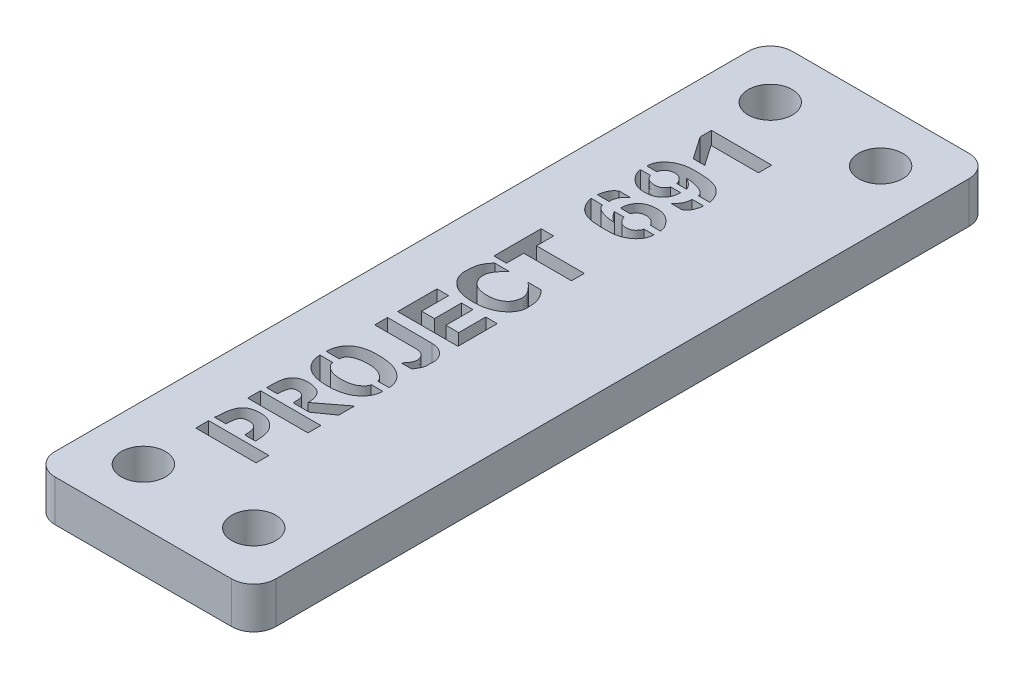
from build123d import *

# Parameters (mm, degrees)
SKETCH1_W           = 25.4
SKETCH1_H           = 84.836
BOSS_EXTRUDE1_DEPTH = 4.7625
FILLET1_R           = 2.54
SKETCH2_R           = 2.54
CUT_EXTRUDE1_DEPTH  = 4.7625
SKETCH3_W           = 6.937209635
SKETCH3_H           = 1.47773099
SKETCH3_H_2         = 1.477730989
CUT_EXTRUDE3_DEPTH  = 4.7625


with BuildPart() as part:
    # Sketch1 → Boss-Extrude1 (new body)
    with BuildSketch(Plane(origin=(0, 0, 0), x_dir=(1, 0, 0), z_dir=(0, 1, 0))):
        Rectangle(SKETCH1_W, SKETCH1_H)
    extrude(amount=BOSS_EXTRUDE1_DEPTH)

    # Fillet1
    fillet1_edges = [part.edges().sort_by_distance(p)[0] for p in [
        (12.7, 2.38125, 42.418),
        (-12.7, 2.38125, 42.418),
        (12.7, 2.38125, -42.418),
        (-12.7, 2.38125, -42.418),
    ]]
    fillet(fillet1_edges, radius=FILLET1_R)

    # Sketch2 → Cut-Extrude1 (cut)
    with BuildSketch(Plane(origin=(0, 4.7625, 0), x_dir=(1, 0, 0), z_dir=(0, 1, 0))):
        with Locations((6.35, 36.068)):
            Circle(SKETCH2_R)
        with Locations((-6.35, 36.068)):
            Circle(SKETCH2_R)
        with Locations((6.35, -36.068)):
            Circle(SKETCH2_R)
        with Locations((-6.35, -36.068)):
            Circle(SKETCH2_R)
    extrude(amount=-CUT_EXTRUDE1_DEPTH, mode=Mode.SUBTRACT)

    # Sketch3 → Cut-Extrude3 (cut)
    with BuildSketch(Plane(origin=(0, 4.7625, 0), x_dir=(1, 0, 0), z_dir=(0, 1, 0))):
        with BuildLine():
            Line((-2.204557943, -27.318811646), (-3.432489193, -27.318811646))
            add(Edge.make_bspline(
                [(-3.432489193, -27.318811646), (-3.432086244, -27.242043489), (-3.43131662, -27.095417788), (-3.444434951, -26.885090985), (-3.462893716, -26.694079451), (-3.490651172, -26.521824011), (-3.529286887, -26.369068947), (-3.578036003, -26.235963855), (-3.631503271, -26.119599112), (-3.700606609, -26.024876261), (-3.774751798, -25.94326573), (-3.859309551, -25.875236157), (-3.951313004, -25.81606595), (-4.052326275, -25.767662454), (-4.162419043, -25.732227657), (-4.279993593, -25.704130858), (-4.407280254, -25.690675175), (-4.539497775, -25.684071819), (-4.67120632, -25.68931151), (-4.795938487, -25.700663902), (-4.911135214, -25.720321161), (-5.01728325, -25.746758344), (-5.113551653, -25.782898874), (-5.20018799, -25.826377302), (-5.276644926, -25.878356426), (-5.345910846, -25.939667647), (-5.405748322, -26.021181454), (-5.455121107, -26.126788682), (-5.500796447, -26.257094486), (-5.534324196, -26.415150462), (-5.566678309, -26.59815323), (-5.589264627, -26.808329507), (-5.607848058, -27.044153478), (-5.613179732, -27.210425561), (-5.615979687, -27.297744198)],
                knots=[0, 0, 0, 0, 1.620059853, 3.094283102, 4.446036624, 5.669764395, 6.774058916, 7.765531304, 8.660548686, 9.465545705, 10.229819932, 10.982267153, 11.748884886, 12.535069155, 13.338672239, 14.18627352, 15.081979594, 16.035876351, 16.978779197, 17.861689262, 18.67809544, 19.443395835, 20.167134492, 20.8442956, 21.484521806, 22.114153355, 22.787578946, 23.602060283, 24.566476989, 25.696612031, 27.007394411, 28.488900441, 30.156128049, 32, 32, 32, 32], degree=3))
            Line((-5.615979687, -27.297744198), (-6.926675911, -27.297744198))
            add(Edge.make_bspline(
                [(-6.926675911, -27.297744198), (-6.921712564, -27.18334754), (-6.912149702, -26.962939926), (-6.889474751, -26.645831121), (-6.861772416, -26.354612775), (-6.825780895, -26.090107298), (-6.783941902, -25.851579213), (-6.736724336, -25.638719824), (-6.681792385, -25.45199614), (-6.619050018, -25.289274235), (-6.549930048, -25.145269935), (-6.475368605, -25.013851842), (-6.391670351, -24.895266674), (-6.304488565, -24.785514263), (-6.20972416, -24.687152478), (-6.106551853, -24.601539985), (-5.998363784, -24.525480797), (-5.84144082, -24.439916569), (-5.624638239, -24.353975928), (-5.338004568, -24.280368922), (-5.019882446, -24.239015253), (-4.73772238, -24.225933909), (-4.503107017, -24.233735716), (-4.327486567, -24.249429272), (-4.156796234, -24.278965653), (-3.990195633, -24.3168429), (-3.8297448, -24.371191099), (-3.672415085, -24.431572528), (-3.521002812, -24.506675475), (-3.374664778, -24.591583863), (-3.235441884, -24.686356673), (-3.104154991, -24.787205163), (-2.981621264, -24.89435255), (-2.868204891, -25.008408891), (-2.766398735, -25.131578913), (-2.670787271, -25.258608179), (-2.586590412, -25.394214474), (-2.508470134, -25.536587596), (-2.43904046, -25.693136489), (-2.382088863, -25.868028067), (-2.330052116, -26.061697568), (-2.28953676, -26.275159671), (-2.254184606, -26.507963608), (-2.229965258, -26.760683599), (-2.211124708, -27.033142019), (-2.206795653, -27.221466011), (-2.204557943, -27.318811646)],
                knots=[0, 0, 0, 0, 1.699189764, 3.273822559, 4.717445749, 6.039702003, 7.234168391, 8.310453345, 9.273716079, 10.119740721, 10.895518061, 11.642474635, 12.359027655, 13.047258987, 13.721088708, 14.381587928, 15.034110984, 15.680490903, 17.029629755, 18.483046039, 20.061106175, 21.782264105, 22.668591867, 23.543372224, 24.396343774, 25.237738208, 26.075767183, 26.907923794, 27.736877995, 28.580804131, 29.416979643, 30.23438941, 31.03619414, 31.831023051, 32.618286661, 33.405866943, 34.188612909, 34.984695714, 35.814585228, 36.725577301, 37.711441232, 38.788832536, 39.947912176, 41.204878494, 42.555187395, 44, 44, 44, 44], degree=3))
        make_face()
        with Locations((-3.468604818, -28.712272844)):
            Rectangle(SKETCH3_W, SKETCH3_H)
        with Locations((-3.468604818, -22.741156178)):
            Rectangle(SKETCH3_W, SKETCH3_H_2)
        with BuildLine():
            add(Edge.make_bspline(
                [(-3.84781888, -21.337161256), (-3.847753872, -21.265926003), (-3.847629287, -21.129407572), (-3.856412298, -20.93355259), (-3.873130803, -20.756378239), (-3.89422301, -20.597685736), (-3.925514345, -20.458660199), (-3.964855298, -20.338957205), (-4.008862139, -20.236185284), (-4.063781239, -20.151428397), (-4.128253534, -20.083185163), (-4.195373034, -20.020966344), (-4.273923765, -19.972273328), (-4.358233929, -19.928678985), (-4.451978172, -19.898349054), (-4.552643244, -19.875213633), (-4.66106172, -19.862255319), (-4.774288702, -19.857911775), (-4.88643986, -19.862473824), (-4.992170249, -19.874073649), (-5.088903823, -19.893580882), (-5.176763692, -19.919831106), (-5.254934344, -19.956278497), (-5.322499717, -20.001998193), (-5.382848358, -20.053485938), (-5.434618007, -20.116041305), (-5.477796034, -20.195189439), (-5.513801737, -20.29396158), (-5.548974097, -20.41391277), (-5.577494774, -20.55710614), (-5.604854555, -20.722633409), (-5.626833921, -20.910969515), (-5.644452056, -21.121798523), (-5.65341092, -21.269924536), (-5.658114583, -21.34769498)],
                knots=[0, 0, 0, 0, 1.704020633, 3.265661473, 4.687782663, 5.960558721, 7.092940044, 8.090949425, 8.971855951, 9.760657708, 10.491171539, 11.213658047, 11.942593241, 12.693902549, 13.479411519, 14.291598235, 15.162311024, 16.087000325, 16.999698994, 17.845156185, 18.628829851, 19.357567475, 20.033937485, 20.682928481, 21.303797403, 21.926056331, 22.613721948, 23.449414641, 24.436762231, 25.60173672, 26.93927573, 28.450017959, 30.1361567, 32, 32, 32, 32], degree=3))
            Line((-5.658114583, -21.34769498), (-6.907113281, -21.34769498))
            add(Edge.make_bspline(
                [(-6.907113281, -21.34769498), (-6.90682114, -21.22980228), (-6.906261587, -21.003997057), (-6.894238821, -20.680482609), (-6.881787593, -20.38717533), (-6.856193437, -20.1249368), (-6.829476564, -19.892639907), (-6.793612056, -19.691165929), (-6.752510206, -19.519862307), (-6.68978001, -19.334857686), (-6.588099061, -19.139505957), (-6.442249963, -18.935053685), (-6.263862306, -18.767229212), (-6.060311779, -18.632384798), (-5.834664977, -18.53161419), (-5.593774188, -18.45675038), (-5.337194887, -18.413966326), (-5.069279876, -18.399775581), (-4.797286243, -18.412218728), (-4.527748811, -18.448112576), (-4.264957544, -18.509025033), (-4.051778129, -18.577795298), (-3.888464716, -18.647363989), (-3.773840392, -18.708883966), (-3.667821705, -18.780352169), (-3.569622631, -18.859951386), (-3.480426153, -18.949258895), (-3.399855969, -19.048142343), (-3.328371497, -19.156577345), (-3.240615154, -19.313216413), (-3.153034087, -19.528605262), (-3.080046601, -19.808970902), (-3.033969671, -20.11273115), (-3.028839124, -20.323744903), (-3.026188411, -20.432765813)],
                knots=[0, 0, 0, 0, 1.545689895, 2.960529795, 4.244762436, 5.394017444, 6.414580785, 7.309945393, 8.075641602, 8.72251512, 9.866752923, 10.949451079, 12.000892828, 13.058917368, 14.136147873, 15.230450672, 16.35823801, 17.537386422, 18.742157286, 19.923486542, 21.0977639, 22.274984682, 22.855342685, 23.423306737, 23.977859707, 24.529479651, 25.078269143, 25.629889087, 26.199032476, 26.779092248, 27.98221028, 29.234586207, 30.571240389, 32, 32, 32, 32], degree=3))
            Line((-3.026188411, -20.432765813), (0, -18.122870631))
            Line((0, -18.122870631), (0, -19.933166334))
            Line((0, -19.933166334), (-1.986359375, -21.337161256))
            Line((-1.986359375, -21.337161256), (-3.84781888, -21.337161256))
        make_face()
        with BuildLine():
            add(Edge.make_bspline(
                [(-1.17526263, -14.302138469), (-1.176933137, -14.270320689), (-1.180340607, -14.205419324), (-1.211408481, -14.10939091), (-1.259105899, -14.013500009), (-1.324990391, -13.916470126), (-1.409867757, -13.818610025), (-1.514991417, -13.721397576), (-1.636947573, -13.622137312), (-1.775605988, -13.523710973), (-1.92952388, -13.430176335), (-2.099041038, -13.349129248), (-2.280756724, -13.280266035), (-2.47540848, -13.223881852), (-2.682505224, -13.183037248), (-2.902068659, -13.152836031), (-3.134201346, -13.134649564), (-3.375341466, -13.131311582), (-3.61626525, -13.137306834), (-3.848870711, -13.15140983), (-4.068120674, -13.177746639), (-4.275819162, -13.210050723), (-4.471102199, -13.252966051), (-4.653462371, -13.308176594), (-4.824324934, -13.368543178), (-4.980858056, -13.440815051), (-5.121393437, -13.521277307), (-5.245691328, -13.608116842), (-5.348101515, -13.705591479), (-5.434800426, -13.808282107), (-5.500001896, -13.920980862), (-5.545735921, -14.041376551), (-5.571841994, -14.169580802), (-5.57416518, -14.25737723), (-5.575349609, -14.302138469)],
                knots=[0, 0, 0, 0, 0.559551673, 1.141363957, 1.762179237, 2.443913102, 3.20250351, 4.040654274, 4.964481152, 5.97279125, 7.03575374, 8.135123237, 9.279679308, 10.457759393, 11.702785314, 12.996979229, 14.362738502, 15.804190176, 17.245831659, 18.610331059, 19.909950123, 21.136790735, 22.314472596, 23.430673126, 24.493525292, 25.506283696, 26.464789682, 27.34564422, 28.171296493, 28.950175142, 29.70690828, 30.454076609, 31.211842126, 32, 32, 32, 32], degree=3))
            Line((-5.575349609, -14.302138469), (-7.072643229, -14.302138469))
            add(Edge.make_bspline(
                [(-7.072643229, -14.302138469), (-7.070053996, -14.205688359), (-7.064974851, -14.016487887), (-7.024691446, -13.739763459), (-6.960781089, -13.476069688), (-6.868281915, -13.22693284), (-6.750778594, -12.991505893), (-6.604026538, -12.772136693), (-6.433764246, -12.565290762), (-6.236821326, -12.372530739), (-6.01076592, -12.197738151), (-5.750124588, -12.051409606), (-5.460800465, -11.924891132), (-5.13802578, -11.827830796), (-4.785007759, -11.750581216), (-4.399835445, -11.701093834), (-3.983692041, -11.674714797), (-3.546103019, -11.672385111), (-3.107073646, -11.692760084), (-2.686691187, -11.734918395), (-2.295496895, -11.802582549), (-1.933081824, -11.892281141), (-1.59861989, -12.004436696), (-1.292824692, -12.141467058), (-1.015849258, -12.302270854), (-0.770312417, -12.486814989), (-0.554714903, -12.686293548), (-0.36247581, -12.891080884), (-0.204973892, -13.108560267), (-0.070943722, -13.330171343), (0.029185523, -13.562592647), (0.105113723, -13.801550129), (0.146968569, -14.049869881), (0.153311394, -14.217727225), (0.156501042, -14.302138469)],
                knots=[0, 0, 0, 0, 0.920346871, 1.805389965, 2.663603329, 3.505921104, 4.336769663, 5.169437479, 6.019773897, 6.889978583, 7.795002015, 8.738717905, 9.735886095, 10.803615248, 11.950360416, 13.182160892, 14.506515913, 15.928648215, 17.357110269, 18.700219705, 19.958946806, 21.143485947, 22.260957422, 23.321793063, 24.336827028, 25.311708212, 26.247066261, 27.138304861, 27.987778048, 28.805680415, 29.605441448, 30.397525795, 31.194155961, 32, 32, 32, 32], degree=3))
            Line((0.156501042, -14.302138469), (-1.17526263, -14.302138469))
        make_face()
        with BuildLine():
            add(Edge.make_bspline(
                [(0.156501042, -15.03047024), (0.153682672, -15.1199529), (0.148104172, -15.297069145), (0.101349859, -15.557277814), (0.026212212, -15.80828382), (-0.082116267, -16.048061729), (-0.218545806, -16.279332634), (-0.386976583, -16.498830253), (-0.584534167, -16.709478238), (-0.810458157, -16.908603269), (-1.065092754, -17.090834972), (-1.346085708, -17.250971347), (-1.653418937, -17.38507378), (-1.98612729, -17.492130722), (-2.343135439, -17.578387266), (-2.725502238, -17.639413191), (-3.133326905, -17.67454055), (-3.556880155, -17.685710937), (-3.978977862, -17.67481494), (-4.381566132, -17.638977775), (-4.756468423, -17.581251044), (-5.103159616, -17.499520659), (-5.421722405, -17.392494242), (-5.711549193, -17.262130559), (-5.973515335, -17.107787394), (-6.205448706, -16.929811976), (-6.408609528, -16.733376267), (-6.58593024, -16.524578273), (-6.737467082, -16.304868716), (-6.860372979, -16.072456399), (-6.955862639, -15.828611624), (-7.023367495, -15.572644415), (-7.065142939, -15.3052195), (-7.070119512, -15.122918576), (-7.072643229, -15.03047024)],
                knots=[0, 0, 0, 0, 0.853788275, 1.689933833, 2.515604473, 3.349525323, 4.195487693, 5.073811264, 5.985247159, 6.948898209, 7.944298668, 8.969549936, 10.03104821, 11.139619114, 12.302323729, 13.534477937, 14.832609361, 16.207589621, 17.577782735, 18.861604178, 20.063875084, 21.196402976, 22.258020076, 23.267502423, 24.225161109, 25.154278776, 26.051819322, 26.918259964, 27.765739173, 28.594805511, 29.42276458, 30.260307849, 31.117768349, 32, 32, 32, 32], degree=3))
            Line((-7.072643229, -15.03047024), (-5.596417057, -15.03047024))
            add(Edge.make_bspline(
                [(-5.596417057, -15.03047024), (-5.59418075, -15.063796608), (-5.589630293, -15.131609384), (-5.558360923, -15.231422111), (-5.515055036, -15.332306207), (-5.451762082, -15.431565785), (-5.372985397, -15.531242211), (-5.276876069, -15.630499075), (-5.165845271, -15.731248558), (-5.038232395, -15.830259566), (-4.894168149, -15.924618009), (-4.730936409, -16.004564907), (-4.55257462, -16.074781774), (-4.357017638, -16.128804518), (-4.145897111, -16.175601915), (-3.917067755, -16.203045001), (-3.672661376, -16.223892169), (-3.416924159, -16.22838678), (-3.16077646, -16.223552934), (-2.91399163, -16.204200131), (-2.682886983, -16.171123665), (-2.466737835, -16.127075987), (-2.266854536, -16.067430889), (-2.08132654, -15.997918566), (-1.911297476, -15.913275878), (-1.758987956, -15.815372223), (-1.624246377, -15.712317058), (-1.505022047, -15.610972656), (-1.404417058, -15.511199701), (-1.321562253, -15.412104382), (-1.256175433, -15.315267527), (-1.210055351, -15.219007303), (-1.180810879, -15.124473852), (-1.177079775, -15.061258001), (-1.17526263, -15.03047024)],
                knots=[0, 0, 0, 0, 0.586688794, 1.193799336, 1.831051319, 2.517875258, 3.260615898, 4.067157841, 4.949574073, 5.90085298, 6.911050796, 7.978417371, 9.097950677, 10.284242926, 11.549887516, 12.905094796, 14.34172073, 15.871388074, 17.409892715, 18.855330142, 20.230456225, 21.522043046, 22.738739217, 23.902689247, 25.009587917, 26.078746574, 27.088247994, 27.99718535, 28.834762146, 29.581751398, 30.270676851, 30.887491563, 31.458179498, 32, 32, 32, 32], degree=3))
            Line((-1.17526263, -15.03047024), (0.156501042, -15.03047024))
        make_face()
        with BuildLine():
            Line((-6.926675911, -8.874260995), (-6.926675911, -7.396530006))
            Line((-6.926675911, -7.396530006), (-1.810295703, -7.40706373))
            add(Edge.make_bspline(
                [(-1.810295703, -7.40706373), (-1.737491363, -7.41052985), (-1.594878071, -7.417319483), (-1.386499947, -7.445032674), (-1.190774984, -7.493028043), (-1.004816741, -7.551940229), (-0.831688895, -7.631543927), (-0.667975095, -7.724305188), (-0.516521254, -7.835432556), (-0.378172376, -7.960777291), (-0.25412853, -8.096328746), (-0.143167563, -8.235530312), (-0.05141616, -8.380838461), (0.024520868, -8.528792311), (0.084108043, -8.680887215), (0.12645489, -8.837251454), (0.150201643, -8.99790952), (0.160156589, -9.20874337), (0.153890153, -9.45467783), (0.146907522, -9.720699429), (0.131465329, -9.943996328), (0.115783383, -10.107177103), (0.090863992, -10.227974972), (0.057980888, -10.324364871), (0.012549682, -10.432105779), (-0.045635935, -10.551906857), (-0.115460621, -10.683485682), (-0.201493097, -10.825532778), (-0.298437732, -10.979808985), (-0.369393692, -11.085527797), (-0.406300781, -11.140516464)],
                knots=[0, 0, 0, 0, 1.215774492, 2.38152841, 3.499943313, 4.574381322, 5.630576831, 6.672721368, 7.70883401, 8.757576902, 9.782134528, 10.77153606, 11.723382411, 12.644074726, 13.542320429, 14.443640527, 15.340755012, 16.245951772, 17.961585553, 19.443669169, 20.685038119, 21.696074975, 22.17535241, 22.739034778, 23.391781445, 24.125402853, 24.96028863, 25.875946883, 26.89519331, 28, 28, 28, 28], degree=3))
            Line((-0.406300781, -11.140516464), (-1.611659766, -11.140516464))
            add(Edge.make_bspline(
                [(-1.611659766, -11.140516464), (-1.555645054, -11.078522913), (-1.448822709, -10.960298677), (-1.308906829, -10.779901208), (-1.189713752, -10.610321257), (-1.096478603, -10.447986801), (-1.024765342, -10.294953361), (-0.979608093, -10.149658065), (-0.953773005, -10.01284842), (-0.960902551, -9.846074019), (-0.998009172, -9.656944514), (-1.071881974, -9.451413305), (-1.1813056, -9.275221289), (-1.298666603, -9.153224388), (-1.406713319, -9.070208795), (-1.499099073, -9.017699508), (-1.60115052, -8.974763671), (-1.711287435, -8.936162059), (-1.831903376, -8.908199982), (-1.961795014, -8.889231691), (-2.100994033, -8.876914629), (-2.197006503, -8.87516594), (-2.246692839, -8.874260995)],
                knots=[0, 0, 0, 0, 1.52682091, 2.911709905, 4.170758681, 5.312664321, 6.330329213, 7.252596346, 8.089247554, 8.859715672, 10.287649864, 11.599132905, 12.830633069, 14.049885, 14.671597463, 15.31647816, 15.985924738, 16.693474089, 17.447450553, 18.244998475, 19.091788859, 20, 20, 20, 20], degree=3))
            Line((-2.246692839, -8.874260995), (-6.926675911, -8.874260995))
        make_face()
        Polygon((-6.9342, -6.224277011), (-6.9342, -1.699290162), (-5.585883333, -1.699290162), (-5.585883333, -4.809748365), (-4.114171615, -4.809748365), (-4.114171615, -1.699290162), (-2.792941667, -1.699290162), (-2.792941667, -4.809748365), (-1.321229948, -4.809748365), (-1.321229948, -1.699290162), (0, -1.699290162), (0, -6.224277011), align=None)
        with BuildLine():
            add(Edge.make_bspline(
                [(-0.842697917, 4.192071166), (-0.769155384, 4.11651892), (-0.623127453, 3.966500452), (-0.428226109, 3.721399238), (-0.259086872, 3.461441745), (-0.132648637, 3.234829883), (-0.047733057, 3.039675523), (0.007232967, 2.87911242), (0.054255663, 2.704721472), (0.091015358, 2.516010768), (0.12107844, 2.313702338), (0.142178703, 2.097237217), (0.1528624, 1.867244059), (0.159707987, 1.626778524), (0.147385278, 1.381060154), (0.099928562, 1.138647294), (0.020709213, 0.903047376), (-0.090344043, 0.675055398), (-0.231516128, 0.453788697), (-0.404676742, 0.240816424), (-0.609932145, 0.036006896), (-0.842400789, -0.161257333), (-1.102267116, -0.343066786), (-1.386043775, -0.503262375), (-1.69320913, -0.637433939), (-2.023236361, -0.744898813), (-2.374785527, -0.830773906), (-2.749026303, -0.892300224), (-3.145853845, -0.927323762), (-3.556880642, -0.938638188), (-3.965949957, -0.927603002), (-4.357625146, -0.89195761), (-4.723517118, -0.832736517), (-5.064457338, -0.74861917), (-5.379696315, -0.640294932), (-5.671176081, -0.509967095), (-5.936091205, -0.352707463), (-6.173623719, -0.171991912), (-6.382760992, 0.025535856), (-6.568631257, 0.22948743), (-6.723081502, 0.445205546), (-6.850134276, 0.668667619), (-6.95100804, 0.900372388), (-7.021642789, 1.140989481), (-7.064882009, 1.389977952), (-7.074850144, 1.642832456), (-7.071570956, 1.890868097), (-7.058179175, 2.127074934), (-7.044003615, 2.347762777), (-7.016911492, 2.551808091), (-6.987231377, 2.740710659), (-6.945184801, 2.912849843), (-6.902237168, 3.070867947), (-6.827899923, 3.257914716), (-6.719513587, 3.477719511), (-6.563606885, 3.728919105), (-6.379609839, 3.968979798), (-6.239341642, 4.117032031), (-6.168247786, 4.192071166)],
                knots=[0, 0, 0, 0, 1.142102602, 2.267788091, 3.386469574, 4.500532407, 5.075110759, 5.690534852, 6.337967116, 7.030899795, 7.772743646, 8.553780998, 9.38659623, 10.267348619, 11.16047737, 12.046381184, 12.93508228, 13.846776553, 14.787737289, 15.77335943, 16.815008932, 17.925831272, 19.073418424, 20.246596944, 21.451460151, 22.699425793, 24.003318156, 25.369697712, 26.805256227, 28.317037304, 29.823384826, 31.237291449, 32.575969623, 33.836339543, 35.037948929, 36.183770988, 37.29034247, 38.36882713, 39.411043808, 40.404177068, 41.354558347, 42.279605007, 43.185365136, 44.086628527, 44.991001142, 45.916383134, 46.824228694, 47.678758263, 48.480056567, 49.219686519, 49.908684965, 50.550801302, 51.139176072, 51.681260279, 52.729033148, 53.790965847, 54.880368043, 56, 56, 56, 56], degree=3))
            Line((-6.168247786, 4.192071166), (-4.451250781, 4.192071166))
            add(Edge.make_bspline(
                [(-4.451250781, 4.192071166), (-4.545595179, 4.108424617), (-4.726484314, 3.948046765), (-4.969959057, 3.699645969), (-5.174444541, 3.456039217), (-5.340277169, 3.217507363), (-5.468565723, 2.984886842), (-5.560088003, 2.757411227), (-5.611269613, 2.533819734), (-5.622588252, 2.316762554), (-5.603795688, 2.110828345), (-5.571478966, 1.915829236), (-5.522324346, 1.732301504), (-5.45372998, 1.561839046), (-5.370669601, 1.401816101), (-5.270009135, 1.253473736), (-5.149106912, 1.119692032), (-5.015364731, 0.995112517), (-4.864239579, 0.885138398), (-4.697531826, 0.790900478), (-4.517921002, 0.708306259), (-4.322534928, 0.644916536), (-4.113824759, 0.593685961), (-3.89112755, 0.555628488), (-3.653581358, 0.536057126), (-3.406908278, 0.528170842), (-3.159230082, 0.536086437), (-2.920295161, 0.555860089), (-2.695152433, 0.592511351), (-2.483448858, 0.641260841), (-2.285845645, 0.706472568), (-2.100909846, 0.784238604), (-1.93039185, 0.878163131), (-1.773170576, 0.984886379), (-1.631412505, 1.105021915), (-1.507014715, 1.23823385), (-1.400414858, 1.38430151), (-1.312302881, 1.542922335), (-1.238213506, 1.712616528), (-1.187010542, 1.895705891), (-1.15098072, 2.090096905), (-1.129858317, 2.295424925), (-1.136410198, 2.513113664), (-1.191731208, 2.737102226), (-1.282805687, 2.96796972), (-1.418077593, 3.202490392), (-1.591803852, 3.443661125), (-1.80770186, 3.688990614), (-2.060133584, 3.944944065), (-2.250865254, 4.107259202), (-2.35052526, 4.192071166)],
                knots=[0, 0, 0, 0, 1.644457997, 3.152964999, 4.532843094, 5.788876873, 6.936739459, 7.991466232, 8.977304869, 9.914492674, 10.81384118, 11.670143911, 12.49082873, 13.286722025, 14.062344171, 14.839152306, 15.617859763, 16.409734935, 17.219891492, 18.049372533, 18.904474348, 19.794249952, 20.724260177, 21.706421881, 22.73783236, 23.831091397, 24.924350434, 25.968796894, 26.956349637, 27.897549355, 28.799749926, 29.667551167, 30.510955973, 31.334947132, 32.142642367, 32.929717677, 33.707159434, 34.495267687, 35.292612216, 36.116837179, 36.96900467, 37.869495086, 38.806043048, 39.793335612, 40.862637167, 42.034641504, 43.314850825, 44.734359334, 46.293656371, 48, 48, 48, 48], degree=3))
            Line((-2.35052526, 4.192071166), (-0.842697917, 4.192071166))
        make_face()
        Polygon((-6.9342, 4.855695776), (-6.9342, 10.285078067), (-5.489575, 10.285078067), (-5.489575, 8.318281322), (0, 8.318281322), (0, 6.842055151), (-5.489575, 6.842055151), (-5.489575, 4.855695776), align=None)
        with BuildLine():
            add(Edge.make_bspline(
                [(-5.751413281, 16.907780802), (-5.749215461, 16.984683116), (-5.74488097, 17.136348105), (-5.70701531, 17.358732387), (-5.648874903, 17.573241165), (-5.563726077, 17.77962671), (-5.450960019, 17.97869527), (-5.308881161, 18.17089911), (-5.139007888, 18.358207246), (-5.007807394, 18.471628998), (-4.940316536, 18.529974291)],
                knots=[0, 0, 0, 0, 0.981416672, 1.935527552, 2.872649936, 3.814794331, 4.77857579, 5.786904786, 6.861561505, 8, 8, 8, 8], degree=3))
            Line((-4.940316536, 18.529974291), (-6.189315234, 18.529974291))
            add(Edge.make_bspline(
                [(-6.189315234, 18.529974291), (-6.230373017, 18.504535397), (-6.311612887, 18.45420018), (-6.424654108, 18.368315422), (-6.526412863, 18.274750497), (-6.619783282, 18.176689433), (-6.701110714, 18.070265007), (-6.773516088, 17.957728936), (-6.835253885, 17.838023673), (-6.902918196, 17.675950201), (-6.965375757, 17.480249218), (-7.025977085, 17.265418812), (-7.063575025, 17.077615935), (-7.069797312, 16.961080967), (-7.072643229, 16.907780802)],
                knots=[0, 0, 0, 0, 0.902701417, 1.786149687, 2.649151757, 3.485131382, 4.314244312, 5.149329194, 5.984045373, 6.828816213, 8.430272808, 9.820342073, 11.003079253, 12, 12, 12, 12], degree=3))
            Line((-7.072643229, 16.907780802), (-5.751413281, 16.907780802))
        make_face()
        with BuildLine():
            add(Edge.make_bspline(
                [(-3.275988151, 16.907780802), (-3.271472985, 16.936853378), (-3.260925134, 17.004769637), (-3.19995319, 17.108849219), (-3.105417788, 17.226292967), (-3.007471412, 17.335577247), (-2.909610972, 17.422526039), (-2.825854647, 17.482904508), (-2.733495927, 17.532921439), (-2.635019648, 17.575186594), (-2.528326882, 17.606567263), (-2.415006009, 17.6290616), (-2.294174951, 17.642431342), (-2.168467067, 17.64633171), (-2.041991202, 17.643202597), (-1.919781218, 17.625795255), (-1.803510134, 17.600348247), (-1.692524289, 17.566274453), (-1.588519672, 17.519540467), (-1.491766882, 17.460917003), (-1.399090162, 17.395744068), (-1.317085632, 17.318728261), (-1.243137862, 17.242191786), (-1.176254385, 17.172609945), (-1.119156261, 17.111268204), (-1.071971018, 17.057882167), (-1.037371693, 17.010659545), (-1.011940058, 16.972760331), (-0.992370219, 16.943626411), (-0.989726183, 16.924488858), (-0.988665234, 16.916809708)],
                knots=[0, 0, 0, 0, 0.848617324, 1.982449431, 3.436545942, 5.240768766, 6.231652679, 7.234248317, 8.231856677, 9.276340032, 10.341049835, 11.455338972, 12.628184927, 13.867293084, 15.106401241, 16.297295494, 17.446097863, 18.561148647, 19.663179848, 20.747543236, 21.843297207, 22.946771928, 24.007887427, 24.935260928, 25.749674447, 26.44180137, 27.004159656, 27.444606052, 27.777142173, 28, 28, 28, 28], degree=3))
            Line((-0.988665234, 16.916809708), (0.156501042, 16.916809708))
            add(Edge.make_bspline(
                [(0.156501042, 16.916809708), (0.154509189, 16.970144389), (0.150450726, 17.078815523), (0.115381471, 17.241517099), (0.060283162, 17.405741311), (-0.015776273, 17.572203299), (-0.113863452, 17.740299816), (-0.234505949, 17.909367015), (-0.374596287, 18.081403886), (-0.535087588, 18.251193317), (-0.708905864, 18.415102084), (-0.899419935, 18.5562271), (-1.099760707, 18.676827436), (-1.310994886, 18.774098075), (-1.532330797, 18.852339967), (-1.764698968, 18.905335891), (-2.007358557, 18.939285958), (-2.256243642, 18.948392518), (-2.503095447, 18.939244307), (-2.739776194, 18.91476061), (-2.962432497, 18.871076079), (-3.171253776, 18.809587888), (-3.365735094, 18.729619432), (-3.546572364, 18.633426101), (-3.711314326, 18.517667221), (-3.862241262, 18.387123025), (-3.995702326, 18.241039595), (-4.112536564, 18.083130344), (-4.212656202, 17.914711059), (-4.291786984, 17.733748737), (-4.356565307, 17.543341129), (-4.398432169, 17.340587606), (-4.426951015, 17.127792167), (-4.430087576, 16.982117853), (-4.431688151, 16.907780802)],
                knots=[0, 0, 0, 0, 0.750355394, 1.528873324, 2.332989369, 3.186468007, 4.101149326, 5.069252908, 6.10844306, 7.222788785, 8.357455092, 9.46783137, 10.554430822, 11.644697357, 12.737066891, 13.854162738, 14.99494648, 16.182633948, 17.355930564, 18.471372678, 19.529710703, 20.546576165, 21.531666437, 22.486067545, 23.424654872, 24.360900384, 25.290755979, 26.204782513, 27.123029643, 28.043176503, 28.981311889, 29.949724638, 30.953752245, 32, 32, 32, 32], degree=3))
            Line((-4.431688151, 16.907780802), (-3.275988151, 16.907780802))
        make_face()
        with BuildLine():
            Line((0.167034766, 16.168915307), (-0.97813151, 16.168915307))
            add(Edge.make_bspline(
                [(-0.97813151, 16.168915307), (-0.984082939, 16.127663033), (-0.997128094, 16.037240664), (-1.068436363, 15.901983661), (-1.170099069, 15.752746028), (-1.281787375, 15.624164081), (-1.386338389, 15.521185154), (-1.475638921, 15.451851781), (-1.571433815, 15.394212714), (-1.673085329, 15.344341061), (-1.782004596, 15.309950765), (-1.896270635, 15.280876287), (-2.017634672, 15.267960547), (-2.142856443, 15.260527576), (-2.267604273, 15.267843524), (-2.388407862, 15.281087241), (-2.5018066, 15.309665508), (-2.609593915, 15.344470672), (-2.709650926, 15.393692859), (-2.802867691, 15.452904924), (-2.891749874, 15.52021824), (-2.993216817, 15.625202735), (-3.102060302, 15.756815566), (-3.202031108, 15.913828071), (-3.267785111, 16.06333098), (-3.280542409, 16.162883959), (-3.286521875, 16.209545385)],
                knots=[0, 0, 0, 0, 0.927475074, 2.032966586, 3.375798686, 4.976803487, 5.834806498, 6.659437564, 7.501332334, 8.335396756, 9.187940833, 10.054359069, 10.971160572, 11.915823181, 12.860485791, 13.766139725, 14.632557961, 15.474452731, 16.298394914, 17.121187677, 17.945818743, 18.787788451, 20.384333895, 21.761999943, 22.951028129, 24, 24, 24, 24], degree=3))
            Line((-3.286521875, 16.209545385), (-4.431688151, 16.209545385))
            add(Edge.make_bspline(
                [(-4.431688151, 16.209545385), (-4.43033138, 16.204965798), (-4.42634918, 16.191524452), (-4.410990235, 16.168396225), (-4.390429985, 16.132468079), (-4.358273424, 16.08724439), (-4.319164159, 16.029249096), (-4.271234281, 15.960347427), (-4.213804932, 15.880762977), (-4.12510099, 15.757919093), (-3.992306514, 15.598975766), (-3.79642281, 15.422596807), (-3.566834061, 15.255251892), (-3.396441555, 15.158480741), (-3.307589323, 15.108018822)],
                knots=[0, 0, 0, 0, 0.107234925, 0.314740585, 0.61909808, 1.04234032, 1.562795012, 2.196197582, 2.933359156, 3.774392159, 5.611037011, 7.587220186, 9.698928515, 12, 12, 12, 12], degree=3))
            add(Edge.make_bspline(
                [(-3.307589323, 15.108018822), (-3.396427634, 15.112798938), (-3.570352881, 15.122157319), (-3.824272558, 15.148294809), (-4.065220443, 15.181163702), (-4.292955134, 15.220999277), (-4.50712411, 15.271358881), (-4.709076494, 15.327404792), (-4.897600926, 15.394419445), (-5.072557629, 15.466538729), (-5.229319114, 15.546193307), (-5.368180131, 15.62702524), (-5.485450235, 15.711987446), (-5.581521697, 15.799714206), (-5.658009859, 15.88920577), (-5.710955481, 15.983298011), (-5.745343946, 16.080309135), (-5.749400759, 16.146575375), (-5.751413281, 16.179449031)],
                knots=[0, 0, 0, 0, 1.499814804, 2.936296909, 4.302182762, 5.59947636, 6.832403556, 8.010357135, 9.131089549, 10.20385637, 11.198577165, 12.09348467, 12.910514558, 13.634730622, 14.283349854, 14.885477346, 15.447102571, 16, 16, 16, 16], degree=3))
            Line((-5.751413281, 16.179449031), (-7.072643229, 16.189982755))
            add(Edge.make_bspline(
                [(-7.072643229, 16.189982755), (-7.072225471, 16.169353526), (-7.071322508, 16.124764522), (-7.056657178, 16.054402908), (-7.041915423, 15.973851223), (-7.014075207, 15.885295953), (-6.984383653, 15.785967725), (-6.94120358, 15.679532111), (-6.898092446, 15.561756348), (-6.825156149, 15.396185164), (-6.72127449, 15.188853674), (-6.567367539, 14.955532129), (-6.384238624, 14.743469374), (-6.176122517, 14.549426977), (-5.938986702, 14.378717066), (-5.671938824, 14.235130783), (-5.377551436, 14.116952243), (-5.110335629, 14.039099462), (-4.874872056, 13.99033156), (-4.673114958, 13.95718399), (-4.448577152, 13.930984579), (-4.201696527, 13.908620392), (-3.932288452, 13.890390059), (-3.640229995, 13.879015397), (-3.325687586, 13.872011874), (-2.995041466, 13.867164324), (-2.660435678, 13.876464036), (-2.334863018, 13.905259328), (-2.025691105, 13.958438047), (-1.732480793, 14.030777563), (-1.454188775, 14.12141925), (-1.193480651, 14.236890841), (-0.947945933, 14.370592503), (-0.722093029, 14.525538475), (-0.516341268, 14.693993268), (-0.336454436, 14.875137853), (-0.182463953, 15.065627116), (-0.057090941, 15.26690343), (0.042738645, 15.477551505), (0.11106089, 15.699686358), (0.156645934, 15.930834852), (0.16354514, 16.08894368), (0.167034766, 16.168915307)],
                knots=[0, 0, 0, 0, 0.258221721, 0.558132818, 0.898640276, 1.28488583, 1.720575915, 2.19841396, 2.72412238, 3.293240168, 4.466418006, 5.628394464, 6.788325788, 7.972365138, 9.18920409, 10.441809878, 11.765322105, 13.160831415, 13.925755206, 14.779982171, 15.724097867, 16.760064261, 17.888611064, 19.11002675, 20.425140591, 21.834293582, 23.256653412, 24.621237559, 25.92947289, 27.18665111, 28.406072673, 29.59473182, 30.757474276, 31.907297446, 33.024443337, 34.087556567, 35.103387964, 36.089590438, 37.054866171, 38.017802335, 38.997402139, 40, 40, 40, 40], degree=3))
        make_face()
        with BuildLine():
            Line((0.145967318, 21.900765958), (-1.17526263, 21.900765958))
            add(Edge.make_bspline(
                [(-1.17526263, 21.900765958), (-1.177505176, 21.823876114), (-1.181927875, 21.67223572), (-1.219172279, 21.449538092), (-1.279765212, 21.235571565), (-1.364329989, 21.028895771), (-1.477194531, 20.829802452), (-1.61935432, 20.6381586), (-1.787615358, 20.449836818), (-1.918763819, 20.336821814), (-1.986359375, 20.278572468)],
                knots=[0, 0, 0, 0, 0.981732815, 1.936151043, 2.87530384, 3.817751729, 4.781843651, 5.79049746, 6.86119478, 8, 8, 8, 8], degree=3))
            Line((-1.986359375, 20.278572468), (-0.738865495, 20.278572468))
            add(Edge.make_bspline(
                [(-0.738865495, 20.278572468), (-0.697772937, 20.303975459), (-0.61646426, 20.354239637), (-0.504194003, 20.440439298), (-0.400546562, 20.532094206), (-0.309654668, 20.632327809), (-0.224777199, 20.73626278), (-0.153477858, 20.849518801), (-0.090981036, 20.968610693), (-0.026354222, 21.131918856), (0.039361283, 21.326371051), (0.099379051, 21.542137812), (0.136812594, 21.730442469), (0.143102564, 21.847467266), (0.145967318, 21.900765958)],
                knots=[0, 0, 0, 0, 0.902130626, 1.785020279, 2.641190041, 3.483499652, 4.310496615, 5.14505346, 5.979241836, 6.819881233, 8.423313641, 9.812503944, 11.003709621, 12, 12, 12, 12], degree=3))
        make_face()
        with BuildLine():
            Line((-2.496492578, 21.900765958), (-3.65068776, 21.900765958))
            add(Edge.make_bspline(
                [(-3.65068776, 21.900765958), (-3.66087209, 21.86706198), (-3.683401725, 21.792502494), (-3.75358808, 21.683582261), (-3.845247914, 21.560797211), (-3.942901086, 21.456233997), (-4.033075561, 21.370188456), (-4.114186325, 21.315350734), (-4.201067173, 21.266170747), (-4.297738207, 21.228985272), (-4.401527199, 21.199300958), (-4.513047717, 21.175904295), (-4.633110229, 21.165142382), (-4.798419333, 21.159120606), (-4.998077375, 21.16995232), (-5.219055164, 21.207617209), (-5.411854946, 21.271659652), (-5.575684099, 21.362430476), (-5.708198852, 21.475862466), (-5.817849104, 21.599858222), (-5.899517838, 21.739318621), (-5.933185259, 21.839867469), (-5.950049219, 21.890232234)],
                knots=[0, 0, 0, 0, 0.715897332, 1.583698414, 2.622319798, 3.84739399, 4.499884924, 5.161953047, 5.840456042, 6.534702953, 7.270546337, 8.043928196, 8.85724736, 9.72842699, 11.421000357, 12.929892975, 14.293570183, 15.550098503, 16.727797181, 17.83879812, 18.917457273, 20, 20, 20, 20], degree=3))
            Line((-5.950049219, 21.890232234), (-7.093710677, 21.890232234))
            add(Edge.make_bspline(
                [(-7.093710677, 21.890232234), (-7.091726863, 21.836893881), (-7.087684778, 21.728215267), (-7.052487746, 21.565572051), (-6.997838565, 21.4009136), (-6.919550374, 21.235236861), (-6.821926549, 21.06672405), (-6.701219088, 20.897235167), (-6.559455475, 20.725715078), (-6.397652504, 20.555738883), (-6.222341163, 20.392452257), (-6.031619654, 20.250252812), (-5.830137328, 20.130706762), (-5.618358146, 20.032516483), (-5.396234635, 19.955017967), (-5.16350335, 19.901648531), (-4.920815742, 19.867770199), (-4.671940078, 19.858653595), (-4.425079995, 19.867767803), (-4.187931418, 19.892438899), (-3.964725147, 19.935803264), (-3.755783631, 19.99712822), (-3.562103964, 20.077808188), (-3.381596666, 20.173576551), (-3.216846958, 20.289369461), (-3.066028447, 20.419978621), (-2.93187292, 20.566070409), (-2.816659435, 20.72507808), (-2.714598074, 20.892833829), (-2.636852847, 21.074516958), (-2.571528744, 21.265162763), (-2.529772914, 21.467971197), (-2.501223231, 21.680751386), (-2.498090963, 21.826427823), (-2.496492578, 21.900765958)],
                knots=[0, 0, 0, 0, 0.749496382, 1.527123058, 2.330318545, 3.185763752, 4.099397937, 5.066393227, 6.108867918, 7.226779668, 8.365339679, 9.474444789, 10.565860266, 11.654878656, 12.752660777, 13.868477764, 15.007955528, 16.194283322, 17.366236738, 18.480401886, 19.544451134, 20.560152481, 21.537592667, 22.49090117, 23.428413994, 24.363587685, 25.292378774, 26.211038861, 27.122163358, 28.047706306, 28.984767707, 29.952071809, 30.954949998, 32, 32, 32, 32], degree=3))
        make_face()
        with BuildLine():
            add(Edge.make_bspline(
                [(-2.496492578, 22.586962833), (-2.511079468, 22.626513157), (-2.542310225, 22.711191013), (-2.612936437, 22.836384351), (-2.705431129, 22.967800965), (-2.816451039, 23.109732091), (-2.959992926, 23.256646931), (-3.14445029, 23.401072511), (-3.366833916, 23.548608932), (-3.531624736, 23.640972657), (-3.619086589, 23.689994213)],
                knots=[0, 0, 0, 0, 0.627447975, 1.343375806, 2.133407235, 3.021854083, 4.026238314, 5.185535451, 6.506237888, 8, 8, 8, 8], degree=3))
            add(Edge.make_bspline(
                [(-3.619086589, 23.689994213), (-3.530253171, 23.685184253), (-3.356835894, 23.675794428), (-3.103272669, 23.650151513), (-2.863086799, 23.614903755), (-2.635252061, 23.575478716), (-2.420773725, 23.525619397), (-2.219367848, 23.467177847), (-2.030560813, 23.400677649), (-1.855578222, 23.328522326), (-1.698650015, 23.248335452), (-1.559301628, 23.168800315), (-1.442177443, 23.083553891), (-1.345123029, 22.997335658), (-1.26923245, 22.907453059), (-1.215324234, 22.814446565), (-1.181391608, 22.717668704), (-1.177294929, 22.65142599), (-1.17526263, 22.618564005)],
                knots=[0, 0, 0, 0, 1.500803449, 2.929812407, 4.297777101, 5.595925846, 6.829665761, 8.010732737, 9.132203913, 10.205677879, 11.201054371, 12.103839975, 12.909584566, 13.64052655, 14.289573337, 14.884742677, 15.446738114, 16, 16, 16, 16], degree=3))
            Line((-1.17526263, 22.618564005), (0.145967318, 22.618564005))
            add(Edge.make_bspline(
                [(0.145967318, 22.618564005), (0.145365924, 22.638161768), (0.14404797, 22.681110266), (0.132508591, 22.750018815), (0.114366035, 22.828391251), (0.08807335, 22.915425887), (0.056467223, 23.012440631), (0.01731997, 23.118848641), (-0.029586014, 23.234671961), (-0.101277371, 23.400870937), (-0.204633208, 23.608660039), (-0.360291156, 23.841633036), (-0.542863849, 24.054173596), (-0.752517059, 24.246405197), (-0.987993821, 24.418868249), (-1.255719658, 24.560425718), (-1.549823404, 24.680336278), (-1.817419542, 24.757179356), (-2.053298302, 24.806206163), (-2.25506901, 24.839315015), (-2.479602578, 24.865526482), (-2.726484508, 24.887886959), (-2.995892184, 24.906118417), (-3.287950768, 24.917492759), (-3.602493106, 24.924496296), (-3.933139384, 24.929344179), (-4.267744614, 24.920043108), (-4.59331924, 24.891252654), (-4.902484263, 24.838056967), (-5.19571886, 24.765777268), (-5.474361673, 24.674779533), (-5.736181252, 24.559648798), (-5.983225371, 24.425944003), (-6.210496078, 24.270914753), (-6.417766622, 24.103003206), (-6.59815253, 23.920765029), (-6.752781486, 23.729963968), (-6.879578041, 23.527527961), (-6.977624716, 23.314418015), (-7.048588324, 23.091580901), (-7.093947449, 22.858627031), (-7.100771545, 22.699530134), (-7.104244401, 22.618564005)],
                knots=[0, 0, 0, 0, 0.245537621, 0.538095685, 0.873642495, 1.253663812, 1.677177559, 2.152586362, 2.674492895, 3.243335955, 4.421547503, 5.577726231, 6.745963606, 7.925164578, 9.136318501, 10.393849058, 11.710897004, 13.111770791, 13.876325334, 14.730139942, 15.673799889, 16.709266196, 17.83726822, 19.058094298, 20.3725733, 21.781046057, 23.202719277, 24.566644705, 25.874248518, 27.130819866, 28.349652783, 29.543497395, 30.711193199, 31.865660995, 32.987125248, 34.049725286, 35.07390531, 36.05963172, 37.035847219, 38.006213658, 38.985340585, 40, 40, 40, 40], degree=3))
            Line((-7.104244401, 22.618564005), (-5.950049219, 22.618564005))
            add(Edge.make_bspline(
                [(-5.950049219, 22.618564005), (-5.945932451, 22.661345596), (-5.936981638, 22.754362749), (-5.866028613, 22.892567756), (-5.766331782, 23.044498815), (-5.652436375, 23.172424303), (-5.546281813, 23.275977301), (-5.454333575, 23.343690028), (-5.358059276, 23.402872618), (-5.255383952, 23.451727377), (-5.145775351, 23.486901419), (-5.031324706, 23.515240242), (-4.910070821, 23.528709822), (-4.785320724, 23.535933648), (-4.660568191, 23.528716167), (-4.539321241, 23.515216392), (-4.425308944, 23.487100895), (-4.317089009, 23.45200941), (-4.217021437, 23.402824198), (-4.123815485, 23.343595764), (-4.034900235, 23.276311503), (-3.933863874, 23.171474118), (-3.82414091, 23.041085238), (-3.724713004, 22.884138078), (-3.658640731, 22.734237112), (-3.646076067, 22.6341407), (-3.640154036, 22.586962833)],
                knots=[0, 0, 0, 0, 0.950756861, 2.067167101, 3.407359861, 5.008861816, 5.871297013, 6.710200126, 7.548506473, 8.389122927, 9.238033191, 10.111638893, 11.013432643, 11.9540688, 12.894704957, 13.796498707, 14.670104409, 15.508410757, 16.328841036, 17.148126795, 17.969243021, 18.807623987, 20.388723309, 21.760517307, 22.944477478, 24, 24, 24, 24], degree=3))
            Line((-3.640154036, 22.586962833), (-2.496492578, 22.586962833))
        make_face()
        Polygon((-6.937209635, 29.889843171), (0, 29.889843171), (0, 28.36094838), (-5.460983464, 28.36094838), (-3.82825625, 26.010423119), (-5.14798138, 26.010423119), (-6.937209635, 28.579146947), align=None)
    extrude(amount=-CUT_EXTRUDE3_DEPTH, mode=Mode.SUBTRACT)


solid = part.part
